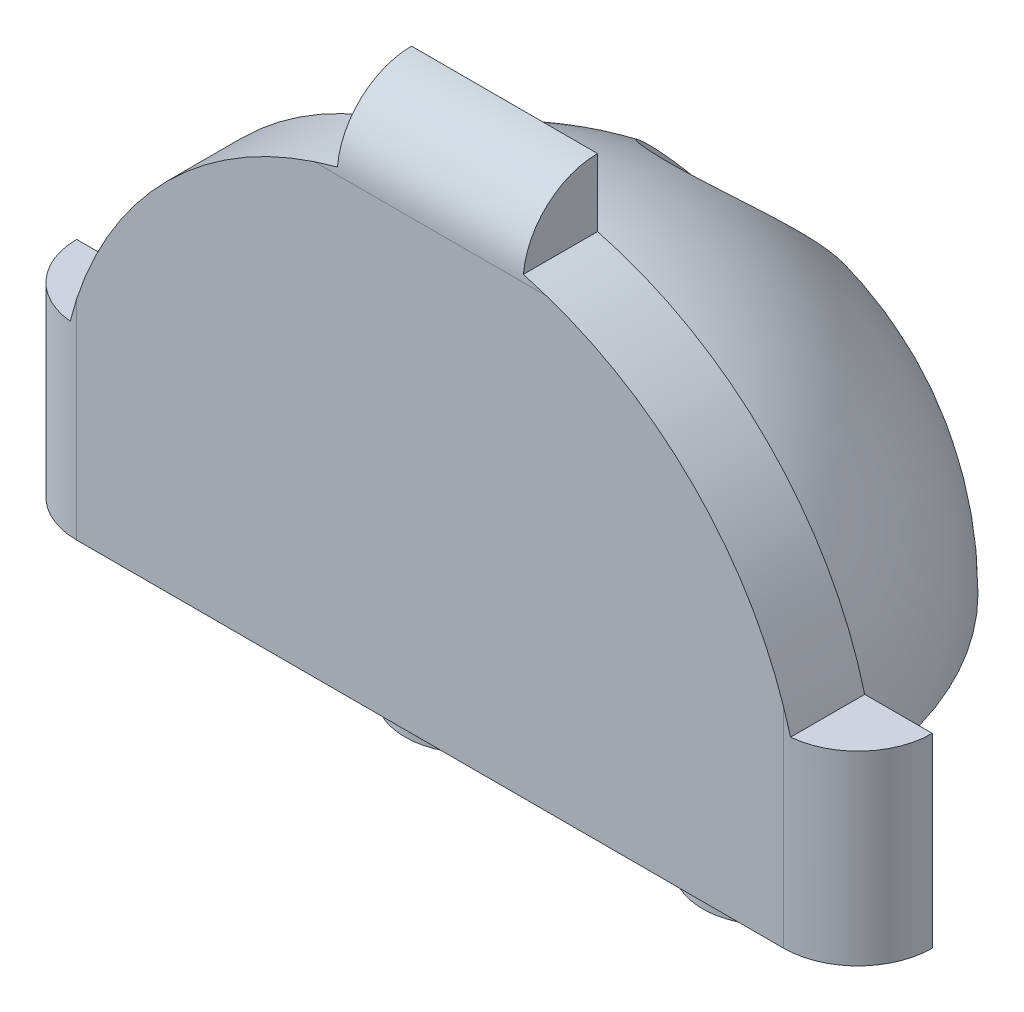
from build123d import *

# Parameters (mm, degrees)
SKETCH_1_R               = 10
EXTRUDE_1_DEPTH          = 2
REVOLVE_1_ANGLE          = 180
SKETCH_5_R               = 2.1
CUT_EXTRUDE_1_DEPTH      = 10
SKETCH_6_R               = 1.85
EXTRUDE_2_DEPTH          = 6
EXTRUDE_START            = 1.38
SKETCH_7_R               = 2.1
EXTRUDE_3_DEPTH          = 1.38
SKETCH_10_W              = 5
SKETCH_10_H              = 23
EXTRUDE_4_DEPTH          = 2
PATTERN_CIRCULAR_3_COUNT = 4
FILLET_3_R               = 2
SKETCH_11_W              = 19.364916732
SKETCH_11_H              = 12.045075347
CUT_EXTRUDE_2_DEPTH      = 10


with BuildPart() as part:
    # 草图1 → 凸台-拉伸1 (new body)
    with BuildSketch(Plane.XY):
        Circle(SKETCH_1_R)
    extrude(amount=EXTRUDE_1_DEPTH)

    # 草图2 → 旋转1 (revolve)
    with BuildSketch(Plane(origin=(0, 0, 0), x_dir=(-1, 0, 0), z_dir=(0, 0, -1))):
        with BuildLine():
            Line((0, 9), (0, 0))
            Line((0, 0), (9, 0))
            ThreePointArc((9, 0), (6.363961031, 6.363961031), (0, 9))
        make_face()
    revolve(axis=Axis((0, 0, 0), (0, -1, 0)), revolution_arc=REVOLVE_1_ANGLE)

    # 草图5 → 切除-拉伸1 (cut)
    with BuildSketch(Plane.XZ):
        with Locations(Location((0, -6.5, 0), (0, 0, 270))):
            Circle(SKETCH_5_R)
    extrude(amount=-CUT_EXTRUDE_1_DEPTH, mode=Mode.SUBTRACT)

    # 草图6 → 凸台-拉伸2 (add)
    with BuildSketch(Plane.XZ):
        with Locations(Location((-4, -3.177350455, 0), (0, 0, 90))):
            Circle(SKETCH_6_R)
    extrude_2 = extrude(amount=EXTRUDE_2_DEPTH)

    # 镜向1: 凸台-拉伸2 across plane
    add(extrude_2.mirror(Plane(origin=(0, 0, 0), x_dir=(0, 0, 1), z_dir=(1, 0, 0))))

    # 草图7 → 凸台-拉伸3 (add)
    with BuildSketch(Plane.XZ.offset(EXTRUDE_START)):
        with BuildLine():
            ThreePointArc((1.939830866, -8.788461538), (0, -3.5), (-1.939830866, -8.788461538))
            ThreePointArc((-1.939830866, -8.788461538), (0, -9), (1.939830866, -8.788461538))
        make_face()
        with Locations(Location((0, -6.5, 0), (0, 0, 270))):
            Circle(SKETCH_7_R, mode=Mode.SUBTRACT)
    extrude(amount=-EXTRUDE_3_DEPTH)

    # 草图8 → 旋转2 (revolve)
    with BuildSketch(Plane.XY.offset(-3.177350455), mode=Mode.PRIVATE) as revolve_2_sk:
        Polygon((4, -3.675756774), (2.15, -3.675756774), (2, -4.087878387), (2, -4.887878387), (2.15, -5.3), (4, -5.3), align=None)
    revolve_2 = revolve(revolve_2_sk.sketch.rotate(Axis((4, -5.3, -3.177350455), (0, 1, 0)), 270), axis=Axis((4, -5.3, -3.177350455), (0, 1, 0)))

    # 镜向2: 旋转2 across plane
    add(revolve_2.mirror(Plane(origin=(0, 0, 0), x_dir=(0, 0, 1), z_dir=(1, 0, 0))))

    # 草图10 → 凸台-拉伸4 (add)
    with BuildSketch(Plane.XY.offset(2)):
        Rectangle(SKETCH_10_W, SKETCH_10_H)
    extrude_4 = extrude(amount=-EXTRUDE_4_DEPTH)

    # 阵列(圆周)3: 凸台-拉伸4 ×4 about axis
    pattern_circular_3_axis = Axis((0, 0, 0), (0, 0, 1))
    for i in range(1, PATTERN_CIRCULAR_3_COUNT):
        add(extrude_4.rotate(pattern_circular_3_axis, i * 360 / PATTERN_CIRCULAR_3_COUNT))

    # 圆角3
    fillet_3_edges = [part.edges().sort_by_distance(p)[0] for p in [
        (0, 11.5, 2),
        (0, -11.5, 2),
        (11.5, 0, 2),
        (-11.5, 0, 2),
    ]]
    fillet(fillet_3_edges, radius=FILLET_3_R - 0.0001)  # a hair under: the kernel refuses the full size

    # 草图11 → 切除-拉伸2 (cut)
    with BuildSketch(Plane(origin=(0, 0, 0), x_dir=(-1, 0, 0), z_dir=(0, 0, -1))):
        with Locations((0, -8.522537674)):
            Rectangle(SKETCH_11_W, SKETCH_11_H)
    extrude(amount=-CUT_EXTRUDE_2_DEPTH, mode=Mode.SUBTRACT)


solid = part.part
